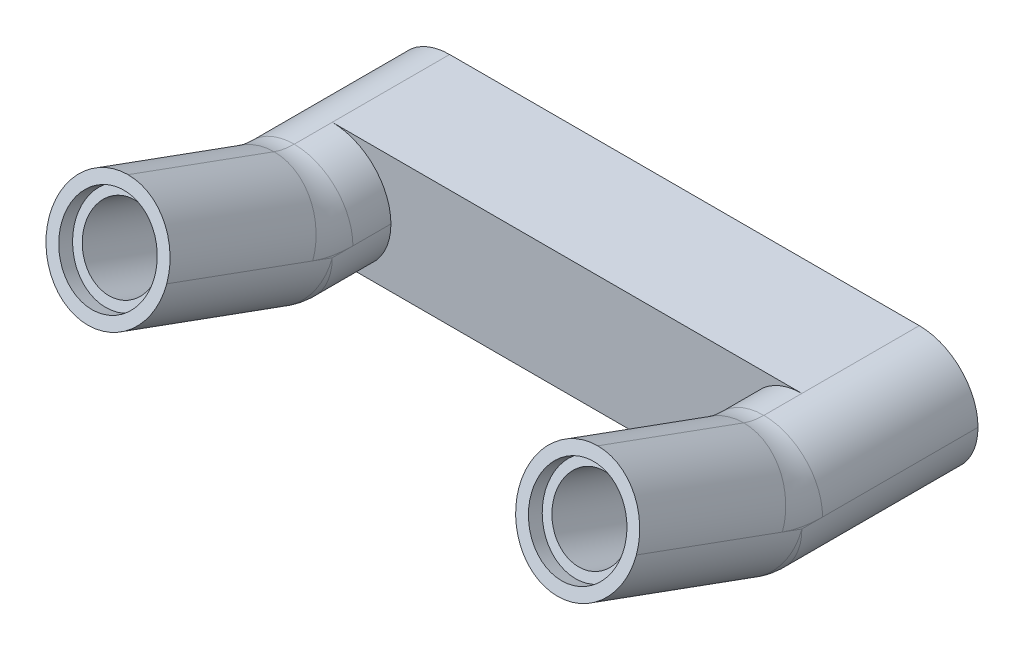
from build123d import *

# Parameters (mm, degrees)
BOSS_EXTRUDE1_DEPTH = 40
FILLET1_R           = 4
SKETCH2_R           = 2.55
CUT_EXTRUDE1_DEPTH  = 8.1
SKETCH3_R           = 3.175
CUT_EXTRUDE2_DEPTH  = 1.1
CUT_EXTRUDE3_START  = -1.1
SKETCH4_R           = 3.175
CUT_EXTRUDE3_DEPTH  = 1.1
FILLET2_R           = 4
SKETCH5_R           = 2.55
CUT_EXTRUDE4_DEPTH  = 8.1
SKETCH6_R           = 3.175
CUT_EXTRUDE5_DEPTH  = 1
CUT_EXTRUDE6_START  = 1.1
SKETCH7_R           = 3.175
CUT_EXTRUDE6_DEPTH  = 1.1
SKETCH8_W           = 24
SKETCH8_H           = 16.644392023
CUT_EXTRUDE7_DEPTH  = 49.456961489
FILLET3_R           = 4
CUT_EXTRUDE8_DEPTH  = 1


with BuildPart() as part:
    # Sketch1 → Boss-Extrude1 (new body)
    with BuildSketch(Plane.YZ):
        with BuildLine():
            Line((2.977553316, 20.886068424), (0.241229517, 13.368080573))
            ThreePointArc((0.241229517, 13.368080573), (0.060768988, 12.694592711), (0, 12))
            Line((0, 12), (0, 0))
            Line((0, 0), (8, 0))
            Line((8, 0), (8, 11.294692077))
            Line((8, 11.294692077), (10.497351308, 18.156108405))
            Line((10.497351308, 18.156108405), (11.863012203, 21.908230876))
            Line((11.863012203, 21.908230876), (4.345471237, 24.644392023))
            Line((4.345471237, 24.644392023), (2.977553316, 20.886068424))
        make_face()
    extrude(amount=BOSS_EXTRUDE1_DEPTH)

    # Fillet1
    fillet1_edges = [part.edges().sort_by_distance(p)[0] for p in [
        (20, 8, 11.294692077),
    ]]
    fillet(fillet1_edges, radius=FILLET1_R)

    # Sketch2 → Cut-Extrude1 (cut)
    with BuildSketch(Plane(origin=(0, 0, 0), x_dir=(1, 0, 0), z_dir=(0, 0, -1))):
        with Locations(Location((4, -4, 0), (0, 0, 180))):
            Circle(SKETCH2_R)
        with Locations(Location((36, -4, 0), (0, 0, 180))):
            Circle(SKETCH2_R)
    extrude(amount=-CUT_EXTRUDE1_DEPTH, mode=Mode.SUBTRACT)

    # Sketch3 → Cut-Extrude2 (cut)
    with BuildSketch(Plane(origin=(0, 0, 8.1), x_dir=(1, 0, 0), z_dir=(0, 0, -1))):
        with Locations(Location((4, -4, 0), (0, 0, 180))):
            Circle(SKETCH3_R)
        with Locations(Location((36, -4, 0), (0, 0, 180))):
            Circle(SKETCH3_R)
    extrude(amount=CUT_EXTRUDE2_DEPTH, mode=Mode.SUBTRACT)

    # Sketch4 → Cut-Extrude3 (cut)
    with BuildSketch(Plane(origin=(0, 0, 0), x_dir=(1, 0, 0), z_dir=(0, 0, -1)).offset(CUT_EXTRUDE3_START)):
        with Locations(Location((36, -4, 0), (0, 0, 180))):
            Circle(SKETCH4_R)
        with Locations(Location((4, -4, 0), (0, 0, 180))):
            Circle(SKETCH4_R)
    extrude(amount=CUT_EXTRUDE3_DEPTH, mode=Mode.SUBTRACT)

    # Fillet2
    fillet2_edges = [part.edges().sort_by_distance(p)[0] for p in [
        (0, 2.293350377, 19.006236298),
        (0, 0, 6),
        (0, 10.05212086, 16.932847802),
        (0, 8, 5.294692077),
        (40, 0, 6),
        (40, 0.060768988, 12.694592711),
        (40, 10.05212086, 16.932847802),
        (40, 8.060768988, 11.283976865),
        (0, 0.060768988, 12.694592711),
        (0, 8.060768988, 11.283976865),
        (40, 2.293350377, 19.006236298),
        (40, 8, 5.294692077),
    ]]
    fillet(fillet2_edges, radius=FILLET2_R - 0.0001)  # a hair under: the kernel refuses the full size

    # Sketch5 → Cut-Extrude4 (cut)
    with BuildSketch(Plane(origin=(0, 8.428878492, 23.158153328), x_dir=(-1, 0, 0), z_dir=(0, 0.34202014332566283, 0.9396926207859106))):
        with Locations(Location((-36, 0.345471237, 0), (0, 0, 90))):
            Circle(SKETCH5_R)
        with Locations(Location((-4, 0.345471237, 0), (0, 0, 90))):
            Circle(SKETCH5_R)
    extrude(amount=-CUT_EXTRUDE4_DEPTH, mode=Mode.SUBTRACT)

    # Sketch6 → Cut-Extrude5 (cut)
    with BuildSketch(Plane(origin=(0, 8.428878492, 23.158153328), x_dir=(-1, 0, 0), z_dir=(0, 0.34202014332566283, 0.9396926207859106))):
        with Locations(Location((-36, 0.345471237, 0), (0, 0, 90))):
            Circle(SKETCH6_R)
        with Locations(Location((-4, 0.345471237, 0), (0, 0, 90))):
            Circle(SKETCH6_R)
    extrude(amount=-CUT_EXTRUDE5_DEPTH, mode=Mode.SUBTRACT)

    # Sketch7 → Cut-Extrude6 (cut)
    with BuildSketch(Plane(origin=(0, 5.658515331, 15.546643099), x_dir=(-1, 0, 0), z_dir=(0, 0.34202014332566283, 0.9396926207859106)).offset(CUT_EXTRUDE6_START)):
        with Locations(Location((-4, 0.345471237, 0), (0, 0, 90))):
            Circle(SKETCH7_R)
        with Locations(Location((-36, 0.345471237, 0), (0, 0, 90))):
            Circle(SKETCH7_R)
    extrude(amount=-CUT_EXTRUDE6_DEPTH, mode=Mode.SUBTRACT)

    # Sketch8 → Cut-Extrude7 (cut, through all)
    with BuildSketch(Plane.XZ):
        with Locations((20, 16.322196012)):
            Rectangle(SKETCH8_W, SKETCH8_H)
    extrude(amount=-CUT_EXTRUDE7_DEPTH, mode=Mode.SUBTRACT)

    # Fillet3
    fillet3_edges = [part.edges().sort_by_distance(p)[0] for p in [
        (8, 8.060768988, 11.283976865),
        (8, 0, 10),
        (8, 0.060768988, 12.694592711),
        (32, 0, 10),
        (32, 0.060768988, 12.694592711),
        (32, 8.060768988, 11.283976865),
        (8, 10.05212086, 16.932847802),
        (8, 2.293350377, 19.006236298),
        (32, 2.293350377, 19.006236298),
        (32, 10.05212086, 16.932847802),
        (8, 8, 9.294692077),
        (32, 8, 9.294692077),
    ]]
    fillet(fillet3_edges, radius=FILLET3_R - 0.0001)  # a hair under: the kernel refuses the full size

    # Sketch9 → Cut-Extrude8 (cut)
    # profile 1 of 5: a face of its own
    with BuildSketch(Plane.XZ):
        Polygon((6.647435897, 6.25), (9.467948718, 6.25), (9.467948718, 5.352564103), (7.737179487, 5.352564103), (7.737179487, 4.391025641), (9.467948718, 4.391025641), (9.467948718, 3.493589744), (7.737179487, 3.493589744), (7.737179487, 1.25), (6.647435897, 1.25), align=None)
    # profile 2 of 5: a face of its own
    with BuildSketch(Plane.XZ):
        Polygon((13.838541667, 6.25), (14.956330128, 6.25), (17.217948718, 1.25), (16.052083333, 1.25), (15.597355769, 2.275641026), (13.196514423, 2.275641026), (12.742788462, 1.25), (11.576923077, 1.25), align=None)
        Polygon((14.397435897, 4.908854167), (13.595152244, 3.173076923), (15.201722756, 3.173076923), align=None, mode=Mode.SUBTRACT)
    # profile 3 of 5: a face of its own
    with BuildSketch(Plane.XZ):
        with BuildLine():
            Line((22.724358974, 5.58193109), (21.886017628, 4.967948718))
            add(Edge.make_bspline(
                [(21.886017628, 4.967948718), (21.849919505, 5.00860946), (21.78009147, 5.087263403), (21.66845127, 5.191767366), (21.556279408, 5.280405729), (21.443760541, 5.353224011), (21.330792108, 5.410366333), (21.216751074, 5.450747394), (21.10187026, 5.47602852), (21.024762013, 5.479199154), (20.986578526, 5.480769231)],
                knots=[0, 0, 0, 0, 1.221275186, 2.362428825, 3.431016632, 4.429913078, 5.369341348, 6.268639847, 7.142642039, 8, 8, 8, 8], degree=3))
            add(Edge.make_bspline(
                [(20.986578526, 5.480769231), (20.951097478, 5.479793851), (20.88291169, 5.477919412), (20.785523385, 5.45869283), (20.698244197, 5.426557563), (20.622478873, 5.382922856), (20.561084814, 5.33172414), (20.514167194, 5.276730679), (20.486544697, 5.216009554), (20.482665534, 5.173853102), (20.480769231, 5.153245192)],
                knots=[0, 0, 0, 0, 1.286278489, 2.47190871, 3.583616279, 4.64755846, 5.62792584, 6.471833469, 7.252965648, 8, 8, 8, 8], degree=3))
            add(Edge.make_bspline(
                [(20.480769231, 5.153245192), (20.481759113, 5.132356649), (20.483769158, 5.089940606), (20.505977894, 5.028739578), (20.536578574, 4.967695111), (20.567045693, 4.932312401), (20.582932692, 4.913862179)],
                knots=[0, 0, 0, 0, 0.937548871, 1.903776294, 2.906929648, 4, 4, 4, 4], degree=3))
            add(Edge.make_bspline(
                [(20.582932692, 4.913862179), (20.597080949, 4.899284149), (20.630029994, 4.86533423), (20.692611151, 4.813073169), (20.770871397, 4.747994879), (20.867693594, 4.673332752), (20.980582974, 4.586687113), (21.112548518, 4.491321902), (21.260142987, 4.382468228), (21.3657037, 4.308021256), (21.421274038, 4.268830128)],
                knots=[0, 0, 0, 0, 0.460236507, 1.071817812, 1.846079868, 2.768076201, 3.842799649, 5.071965004, 6.458594214, 8, 8, 8, 8], degree=3))
            add(Edge.make_bspline(
                [(21.421274038, 4.268830128), (21.473008939, 4.232418421), (21.571177914, 4.163325799), (21.710861993, 4.065480773), (21.833650739, 3.976637389), (21.942066396, 3.900890758), (22.032136629, 3.83264289), (22.107610066, 3.777131943), (22.166599533, 3.731219344), (22.200228943, 3.703644329), (22.214543269, 3.691907051)],
                knots=[0, 0, 0, 0, 1.547641866, 2.936710292, 4.171942255, 5.255262621, 6.171657329, 6.936133225, 7.547166146, 8, 8, 8, 8], degree=3))
            add(Edge.make_bspline(
                [(22.214543269, 3.691907051), (22.269058313, 3.644313804), (22.37304405, 3.553531178), (22.509557109, 3.411249934), (22.621709583, 3.272546385), (22.708939118, 3.134499438), (22.772795528, 2.994254056), (22.820174875, 2.850460542), (22.847363473, 2.699682141), (22.850819885, 2.59692612), (22.852564103, 2.545072115)],
                knots=[0, 0, 0, 0, 1.276526583, 2.43493443, 3.474657694, 4.419532982, 5.307929191, 6.18733263, 7.085269538, 8, 8, 8, 8], degree=3))
            add(Edge.make_bspline(
                [(22.852564103, 2.545072115), (22.850967846, 2.494580153), (22.847832194, 2.395394876), (22.824721093, 2.249571694), (22.784032365, 2.111523299), (22.730038623, 1.979062037), (22.657651772, 1.854802456), (22.571731236, 1.735724638), (22.467872592, 1.625153964), (22.350551089, 1.52177955), (22.220435885, 1.427823529), (22.079769691, 1.345229845), (21.929218984, 1.276450971), (21.769331101, 1.219854693), (21.599991388, 1.176289783), (21.420941117, 1.144139368), (21.232396167, 1.124873031), (21.103477623, 1.122835236), (21.037660256, 1.121794872)],
                knots=[0, 0, 0, 0, 0.939700259, 1.845926089, 2.73882166, 3.613627635, 4.501600527, 5.408997537, 6.341250136, 7.318720483, 8.315672525, 9.323949117, 10.350013553, 11.391747708, 12.477003977, 13.600911914, 14.775182716, 16, 16, 16, 16], degree=3))
            add(Edge.make_bspline(
                [(21.037660256, 1.121794872), (20.985886904, 1.122540387), (20.883866962, 1.124009432), (20.733383156, 1.136346822), (20.587885938, 1.156196142), (20.447366658, 1.184205782), (20.311868841, 1.22029873), (20.181552021, 1.264104394), (20.056620375, 1.316832466), (19.936019615, 1.376560367), (19.820447156, 1.44632227), (19.709050093, 1.524296993), (19.602663267, 1.612132097), (19.499915208, 1.708488222), (19.402364757, 1.81495527), (19.307559888, 1.929562172), (19.217305402, 2.053521323), (19.16245047, 2.1417357), (19.134615385, 2.186498397)],
                knots=[0, 0, 0, 0, 1.083130667, 2.134320523, 3.156824495, 4.154178402, 5.130191439, 6.088927205, 7.028226078, 7.965444552, 8.902298482, 9.850002013, 10.807948518, 11.786433331, 12.794881184, 13.827051463, 14.897378851, 16, 16, 16, 16], degree=3))
            Line((19.134615385, 2.186498397), (20.086137821, 2.66025641))
            add(Edge.make_bspline(
                [(20.086137821, 2.66025641), (20.121556461, 2.609429307), (20.190002867, 2.5112061), (20.304909988, 2.381082013), (20.422189637, 2.269438261), (20.544178482, 2.177899626), (20.670967629, 2.107274719), (20.801900999, 2.056221225), (20.937037685, 2.025023006), (21.028820324, 2.021161737), (21.074719551, 2.019230769)],
                knots=[0, 0, 0, 0, 1.209050236, 2.336485557, 3.383619759, 4.366928439, 5.306794706, 6.208921133, 7.104306266, 8, 8, 8, 8], degree=3))
            add(Edge.make_bspline(
                [(21.074719551, 2.019230769), (21.121616035, 2.020791145), (21.21224255, 2.023806541), (21.341810228, 2.051789998), (21.460610974, 2.095484314), (21.563875821, 2.1585613), (21.65137222, 2.23075433), (21.71540847, 2.312091738), (21.756207467, 2.400320974), (21.760623473, 2.462201929), (21.762820513, 2.492988782)],
                knots=[0, 0, 0, 0, 1.223176065, 2.363763199, 3.44547837, 4.513116674, 5.508951787, 6.39142225, 7.199704549, 8, 8, 8, 8], degree=3))
            add(Edge.make_bspline(
                [(21.762820513, 2.492988782), (21.761181049, 2.521621327), (21.75781896, 2.580338818), (21.72582305, 2.666616132), (21.678099457, 2.752824471), (21.622592636, 2.823095389), (21.566007664, 2.882141855), (21.510576859, 2.932625992), (21.444639988, 2.990053276), (21.366046319, 3.051572451), (21.276900706, 3.119682149), (21.176832305, 3.194094129), (21.064383961, 3.272738921), (20.985609952, 3.327038757), (20.944511218, 3.35536859)],
                knots=[0, 0, 0, 0, 0.835873241, 1.714146576, 2.663982354, 3.716364857, 4.325032755, 5.058533319, 5.911339222, 6.885726203, 7.981033349, 9.197583309, 10.53789618, 12, 12, 12, 12], degree=3))
            add(Edge.make_bspline(
                [(20.944511218, 3.35536859), (20.86619804, 3.409185774), (20.716105429, 3.512330123), (20.503339299, 3.664858958), (20.311889917, 3.80756125), (20.142592988, 3.941568367), (19.995048869, 4.065929701), (19.868100842, 4.179502943), (19.763586902, 4.284370829), (19.678706398, 4.381668503), (19.610738796, 4.475005984), (19.55161292, 4.565454562), (19.502796011, 4.656458308), (19.462295107, 4.747504692), (19.429727146, 4.838027739), (19.408215864, 4.929157182), (19.392814271, 5.01950797), (19.391619667, 5.080064207), (19.391025641, 5.110176282)],
                knots=[0, 0, 0, 0, 1.875904638, 3.595300711, 5.167975192, 6.589564332, 7.857160913, 8.977131668, 9.95123383, 10.778403762, 11.523244971, 12.228971327, 12.910202534, 13.559366066, 14.195174723, 14.805853887, 15.406201266, 16, 16, 16, 16], degree=3))
            add(Edge.make_bspline(
                [(19.391025641, 5.110176282), (19.392254716, 5.153009768), (19.394681807, 5.237594377), (19.417646948, 5.362100388), (19.454806518, 5.48173787), (19.506381434, 5.596661665), (19.572137725, 5.707245381), (19.653927001, 5.812114134), (19.749666347, 5.912605494), (19.85839821, 6.007032818), (19.977883284, 6.093775791), (20.106000141, 6.169821824), (20.241224436, 6.234165001), (20.382817826, 6.287593924), (20.53139389, 6.328454707), (20.686817561, 6.357608621), (20.848979243, 6.374586521), (20.959495715, 6.376986316), (21.015625, 6.378205128)],
                knots=[0, 0, 0, 0, 0.898727369, 1.774744743, 2.648430524, 3.523998918, 4.413739474, 5.343461403, 6.310473423, 7.324163075, 8.363304562, 9.406953458, 10.44805606, 11.504111669, 12.580793738, 13.679438261, 14.821429358, 16, 16, 16, 16], degree=3))
            add(Edge.make_bspline(
                [(21.015625, 6.378205128), (21.088527218, 6.376049043), (21.233367426, 6.37176539), (21.447468257, 6.338565393), (21.656355221, 6.285591327), (21.825821785, 6.222427672), (21.96043163, 6.160103715), (22.063730585, 6.103763626), (22.168700824, 6.037905022), (22.277360919, 5.965534479), (22.385944643, 5.881563868), (22.49753878, 5.790100201), (22.611728573, 5.690519565), (22.686270281, 5.618652908), (22.724358974, 5.58193109)],
                knots=[0, 0, 0, 0, 1.35300284, 2.68811045, 4.012599843, 5.34822536, 6.038744838, 6.765456977, 7.530921319, 8.338946828, 9.188170671, 10.077873014, 11.017847775, 12, 12, 12, 12], degree=3))
        make_face()
    # profile 4 of 5: a face of its own
    with BuildSketch(Plane.XZ):
        Polygon((24.801282051, 6.25), (27.942307692, 6.25), (27.942307692, 5.352564103), (26.916666667, 5.352564103), (26.916666667, 1.25), (25.826923077, 1.25), (25.826923077, 5.352564103), (24.801282051, 5.352564103), align=None)
    # profile 5 of 5: a face of its own
    with BuildSketch(Plane.XZ):
        with BuildLine():
            Line((31.004807692, 6.25), (33.801282051, 6.25))
            Line((33.801282051, 6.25), (33.801282051, 5.416666667))
            Line((33.801282051, 5.416666667), (31.841145833, 5.416666667))
            Line((31.841145833, 5.416666667), (31.595753205, 4.471153846))
            add(Edge.make_bspline(
                [(31.595753205, 4.471153846), (31.629063974, 4.478564005), (31.694694513, 4.493163869), (31.792737741, 4.507835901), (31.887697054, 4.517388758), (31.949965151, 4.518626447), (31.98036859, 4.519230769)],
                knots=[0, 0, 0, 0, 1.053965098, 2.07657466, 3.06085544, 4, 4, 4, 4], degree=3))
            add(Edge.make_bspline(
                [(31.98036859, 4.519230769), (32.046540773, 4.518026926), (32.176595857, 4.515660887), (32.367153659, 4.492817319), (32.549552594, 4.45716628), (32.723162067, 4.406445515), (32.887691934, 4.33925676), (33.044197391, 4.259382384), (33.192470051, 4.164880517), (33.329636641, 4.055732716), (33.455970398, 3.936829484), (33.565172625, 3.807024718), (33.658842514, 3.669900213), (33.733851331, 3.523565444), (33.793620986, 3.369621831), (33.835434859, 3.207268304), (33.861232605, 3.037023378), (33.863983901, 2.920766286), (33.865384615, 2.861578526)],
                knots=[0, 0, 0, 0, 1.130307283, 2.221510638, 3.274352861, 4.30332148, 5.306584843, 6.306777754, 7.30222463, 8.305487992, 9.298168164, 10.261664542, 11.198406649, 12.129747613, 13.065272833, 14.014526673, 14.989173757, 16, 16, 16, 16], degree=3))
            add(Edge.make_bspline(
                [(33.865384615, 2.861578526), (33.863777459, 2.801702382), (33.860598789, 2.683278026), (33.831556393, 2.509609926), (33.785424631, 2.342989003), (33.720995162, 2.183460051), (33.6373, 2.03171544), (33.534804363, 1.887271165), (33.414361058, 1.749950403), (33.276450038, 1.621999238), (33.126680014, 1.504521446), (32.966558592, 1.401546673), (32.797941675, 1.315505794), (32.621501304, 1.245030309), (32.437445616, 1.18999137), (32.245601242, 1.149507277), (32.045366198, 1.126561485), (31.909311694, 1.123401398), (31.840144231, 1.121794872)],
                knots=[0, 0, 0, 0, 0.966793501, 1.912145514, 2.836141084, 3.755701437, 4.68517605, 5.62955799, 6.611981219, 7.6309838, 8.664728594, 9.683731175, 10.70180528, 11.718520855, 12.749291731, 13.801948059, 14.88255316, 16, 16, 16, 16], degree=3))
            add(Edge.make_bspline(
                [(31.840144231, 1.121794872), (31.778013667, 1.123091041), (31.655883607, 1.125638922), (31.476107473, 1.141500821), (31.302968123, 1.169387583), (31.136889844, 1.209956525), (30.976705964, 1.259357553), (30.823988665, 1.322219529), (30.677449596, 1.395138524), (30.538454585, 1.479231305), (30.40824702, 1.57271753), (30.290137768, 1.676265701), (30.182811294, 1.7871426), (30.087187776, 1.906619523), (30.004212225, 2.035103218), (29.932660012, 2.171576005), (29.871823117, 2.315813257), (29.841996897, 2.416873874), (29.826923077, 2.467948718)],
                knots=[0, 0, 0, 0, 1.140877773, 2.242623625, 3.310961015, 4.357762435, 5.379582132, 6.38596585, 7.386675747, 8.382340269, 9.365832325, 10.326063191, 11.26257561, 12.196073301, 13.131320718, 14.066427474, 15.022795242, 16, 16, 16, 16], degree=3))
            Line((29.826923077, 2.467948718), (30.980769231, 2.467948718))
            add(Edge.make_bspline(
                [(30.980769231, 2.467948718), (31.005212044, 2.4325004), (31.053276584, 2.36279455), (31.141106952, 2.27135766), (31.239960467, 2.194229034), (31.348332317, 2.129356758), (31.466563032, 2.081002843), (31.590625212, 2.044557688), (31.721216979, 2.023142277), (31.810018717, 2.02054918), (31.855168269, 2.019230769)],
                knots=[0, 0, 0, 0, 1.005042761, 1.976323942, 2.948764002, 3.928283931, 4.918005859, 5.925468664, 6.945244058, 8, 8, 8, 8], degree=3))
            add(Edge.make_bspline(
                [(31.855168269, 2.019230769), (31.886572661, 2.020154855), (31.948202771, 2.021968344), (32.039130663, 2.031694525), (32.126220905, 2.049876556), (32.209982101, 2.075079123), (32.290193852, 2.107039004), (32.36669316, 2.146227797), (32.439202503, 2.192855936), (32.507920199, 2.245371408), (32.570746133, 2.303739648), (32.624861165, 2.367364222), (32.671875988, 2.434043553), (32.710064902, 2.505271647), (32.739123763, 2.581116623), (32.760054795, 2.660701329), (32.773725303, 2.74425499), (32.774994834, 2.801427842), (32.775641026, 2.830528846)],
                knots=[0, 0, 0, 0, 1.100633831, 2.159958489, 3.199263943, 4.213310163, 5.221265148, 6.22056156, 7.220063371, 8.237881296, 9.247599745, 10.218275378, 11.159387591, 12.101444514, 13.042120388, 13.998379069, 14.981174168, 16, 16, 16, 16], degree=3))
            add(Edge.make_bspline(
                [(32.775641026, 2.830528846), (32.774792033, 2.858932383), (32.773137362, 2.914290355), (32.76248601, 2.995784853), (32.741542393, 3.072478851), (32.716384367, 3.146757977), (32.680510595, 3.215779519), (32.638083358, 3.281627121), (32.588236908, 3.343936537), (32.529815614, 3.40027743), (32.467402296, 3.45216463), (32.401034632, 3.497523634), (32.33113572, 3.535761569), (32.258369624, 3.568153045), (32.181634935, 3.592099016), (32.102098079, 3.608705185), (32.019460095, 3.620736364), (31.963052873, 3.621437442), (31.934294872, 3.621794872)],
                knots=[0, 0, 0, 0, 1.057099519, 2.060267592, 3.04855702, 4.011217421, 4.972353672, 5.933730739, 6.923190618, 7.933410387, 8.948202689, 9.940543778, 10.919103857, 11.909265342, 12.899348895, 13.903208994, 14.930996485, 16, 16, 16, 16], degree=3))
            add(Edge.make_bspline(
                [(31.934294872, 3.621794872), (31.903183436, 3.620839756), (31.840933675, 3.6189287), (31.747958105, 3.603073327), (31.65565289, 3.57809641), (31.564071807, 3.542744525), (31.473901961, 3.497176766), (31.383896291, 3.442646049), (31.294874182, 3.377866111), (31.2387691, 3.327822898), (31.210136218, 3.302283654)],
                knots=[0, 0, 0, 0, 0.921002463, 1.84280093, 2.785578268, 3.749740217, 4.744798683, 5.77424954, 6.864102032, 8, 8, 8, 8], degree=3))
            Line((31.210136218, 3.302283654), (30.282652244, 3.475560897))
            Line((30.282652244, 3.475560897), (31.004807692, 6.25))
        make_face()
    extrude(amount=-CUT_EXTRUDE8_DEPTH, mode=Mode.SUBTRACT)


solid = part.part
